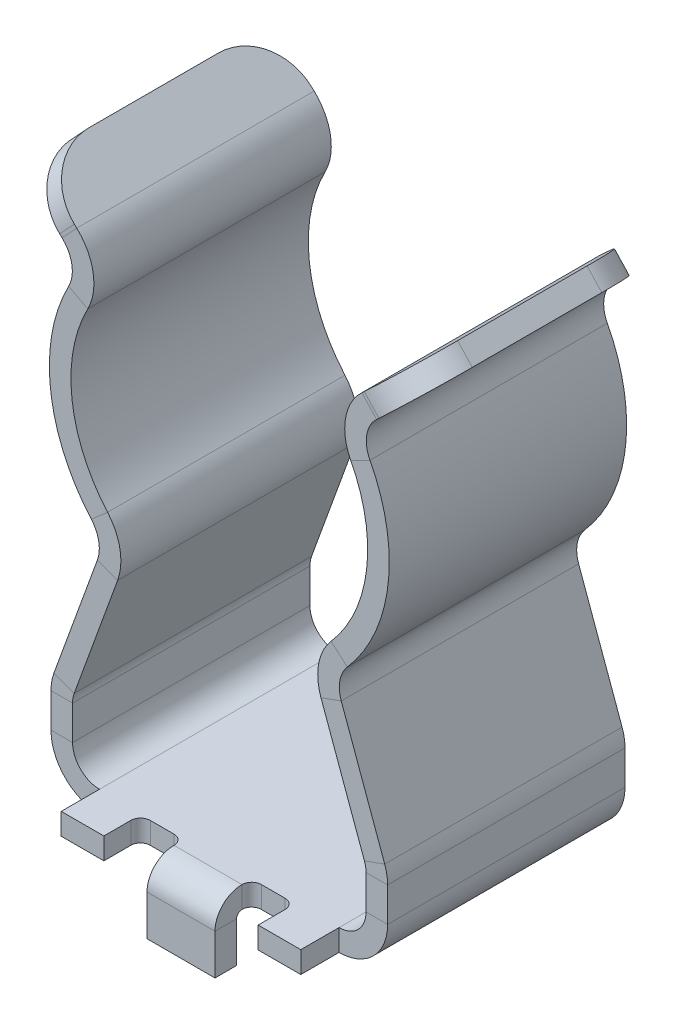
from build123d import *

# Parameters (mm, degrees)
SM_BASE_FLANGE_1_DEPTH            = 2.91
CUT_EXTRUDE_START                 = -9.92
CUT_EXTRUDE_2_OUTLINE_W           = 5
CUT_EXTRUDE_2_OUTLINE_H           = 0.71
CUT_EXTRUDE_2_DEPTH               = 9.52
CUT_EXTRUDE_START_2               = -0.4
CUT_EXTRUDE_2_2_OUTLINE_W         = 0.9
CUT_EXTRUDE_2_2_OUTLINE_H         = 0.71
CUT_EXTRUDE_2_2_DEPTH             = 0.4
SM_EDGE_FLANGE_2_STRIP_W          = 1.8
SM_EDGE_FLANGE_2_STRIP_H          = 0.4
SM_EDGE_FLANGE_2_STRIP_CUT_DEPTH  = 0.63
SM_EDGE_FLANGE_2_RELIEF_W         = 1.98
SM_EDGE_FLANGE_2_RELIEF_H         = 0.8
SM_EDGE_FLANGE_2_RELIEF_CUT_DEPTH = 0.4
SM_EDGE_FLANGE_2_DEPTH            = 0.63
FILLET_3_R                        = 0.18
CUT_EXTRUDE_4_DEPTH               = 12.348755283
FILLET_4_R                        = 1
SKETCH_33_W                       = 2.00295296
SKETCH_33_H                       = 3.384867517
CUT_EXTRUDE_5_DEPTH               = 13.417670735


# Read off the part's stored shape, not the designer's step: 切除-拉伸2
# Sheet-metal steps are written as plain solids
with BuildPart() as part:
    # Sketch 1 → 基体-法兰1 (new body)
    with BuildSketch(Plane.XY):
        with BuildLine():
            Line((-3.4172, 3.19), (-2.64194931, 2.466293544))
            ThreePointArc((-2.64194931, 2.466293544), (-2.338641394, 1.90383514), (-2.437847629, 1.272556064))
            ThreePointArc((-2.437847629, 1.272556064), (-2.730725187, -0.325023008), (-2.071040526, -1.809223905))
            ThreePointArc((-2.071040526, -1.809223905), (-1.841158131, -2.283453933), (-1.884290869, -2.808696355))
            Line((-1.884290869, -2.808696355), (-2.689927651, -5.025447504))
            ThreePointArc((-2.689927651, -5.025447504), (-2.712424525, -5.109527023), (-2.72, -5.196233927))
            Line((-2.72, -5.196233927), (-2.72, -5.83))
            ThreePointArc((-2.72, -5.83), (-2.573553391, -6.183553391), (-2.22, -6.33))
            Line((-2.22, -6.33), (0, -6.33))
            Line((0, -6.33), (0, -6.73))
            Line((0, -6.73), (-2.22, -6.73))
            ThreePointArc((-2.22, -6.73), (-2.856396103, -6.466396103), (-3.12, -5.83))
            Line((-3.12, -5.83), (-3.12, -5.196233927))
            ThreePointArc((-3.12, -5.196233927), (-3.106364145, -5.0401615), (-3.065869772, -4.888818365))
            Line((-3.065869772, -4.888818365), (-2.26023299, -2.672067216))
            ThreePointArc((-2.26023299, -2.672067216), (-2.234353348, -2.356921763), (-2.372282784, -2.072383746))
            ThreePointArc((-2.372282784, -2.072383746), (-3.127921577, -0.372299082), (-2.792443648, 1.457655128))
            ThreePointArc((-2.792443648, 1.457655128), (-2.732919907, 1.836422573), (-2.914904656, 2.173897616))
            Line((-2.914904656, 2.173897616), (-3.690155347, 2.897604072))
            Line((-3.690155347, 2.897604072), (-3.4172, 3.19))
        make_face()
    extrude(amount=SM_BASE_FLANGE_1_DEPTH)

    # 切除-拉伸2 outline → 切除-拉伸2 (cut)
    with BuildSketch(Plane.XZ.offset(6.73).offset(CUT_EXTRUDE_START)):
        with Locations((-2.5, 2.555)):
            Rectangle(CUT_EXTRUDE_2_OUTLINE_W, CUT_EXTRUDE_2_OUTLINE_H)
    extrude(amount=CUT_EXTRUDE_2_DEPTH, mode=Mode.SUBTRACT)

    # Cut-Extrude 2 2 outline → Cut-Extrude 2 2 (cut)
    with BuildSketch(Plane.XZ.offset(6.73).offset(CUT_EXTRUDE_START_2)):
        with Locations((-2.67, 2.555)):
            Rectangle(CUT_EXTRUDE_2_2_OUTLINE_W, CUT_EXTRUDE_2_2_OUTLINE_H)
    extrude(amount=CUT_EXTRUDE_2_2_DEPTH, mode=Mode.SUBTRACT)

    # 边线-法兰2 strip (across the edge) → 边线-法兰2 strip cut (cut)
    with BuildSketch(Plane(origin=(0, -6.73, 2.91), x_dir=(0, 0, -1), z_dir=(-1, 0, 0))):
        with Locations((-0.4, -0.2)):
            Rectangle(SM_EDGE_FLANGE_2_STRIP_W, SM_EDGE_FLANGE_2_STRIP_H)
    extrude(amount=SM_EDGE_FLANGE_2_STRIP_CUT_DEPTH, mode=Mode.SUBTRACT)

    # 边线-法兰2 relief (on the sheet) → 边线-法兰2 relief cut (cut)
    with BuildSketch(Plane(origin=(0, -6.73, 2.41), x_dir=(0, 0, -1), z_dir=(0, -1, 0))):
        with Locations((-0.81, -1.03)):
            Rectangle(SM_EDGE_FLANGE_2_RELIEF_W, SM_EDGE_FLANGE_2_RELIEF_H)
    extrude(amount=-SM_EDGE_FLANGE_2_RELIEF_CUT_DEPTH, mode=Mode.SUBTRACT)

    # 边线-法兰2 section (across the edge) → 边线-法兰2 (add)
    with BuildSketch(Plane(origin=(0, -6.73, 2.91), x_dir=(0, 0, -1), z_dir=(-1, 0, 0))):
        with BuildLine():
            Line((0, 0.1), (0, 3.6))
            Line((0, 3.6), (0.4, 3.6))
            Line((0.4, 3.6), (0.4, 0.1))
            ThreePointArc((0.4, 0.1), (0.429289322, 0.029289322), (0.5, 0))
            Line((0.5, 0), (0.5, -0.4))
            ThreePointArc((0.5, -0.4), (0.146446609, -0.253553391), (0, 0.1))
        make_face()
    extrude(amount=SM_EDGE_FLANGE_2_DEPTH)

    # 圆角3
    fillet_3_edges = [part.edges().sort_by_distance(p)[0] for p in [
        (-1.43, -6.53, 2.23),
        (-0.63, -6.53, 2.23),
    ]]
    fillet(fillet_3_edges, radius=FILLET_3_R)

    # 草图29 → 切除-拉伸4 (cut, through all)
    with BuildSketch(Plane.XY.offset(2.91)):
        with BuildLine():
            Line((-0.63, -8.93), (-1.33273135, -8.93))
            Line((-1.33273135, -8.93), (-1.33273135, -10.562100009))
            Line((-1.33273135, -10.562100009), (0, -10.562100009))
            Line((0, -10.562100009), (0, -10.33))
            ThreePointArc((0, -10.33), (-0.465244282, -9.697609927), (-0.63, -8.93))
        make_face()
    extrude(amount=-CUT_EXTRUDE_4_DEPTH, mode=Mode.SUBTRACT)

    # 圆角4
    fillet_4_edges = [part.edges().sort_by_distance(p)[0] for p in [
        (-3.553677673, 3.043802036, 2.2),
    ]]
    fillet(fillet_4_edges, radius=FILLET_4_R)

    # 镜向8: part across plane


with BuildPart() as part_1:
    add(part.part)
    add(part.part.mirror(Plane(origin=(0, -6.33, 2.91), x_dir=(0, 0, 1), z_dir=(1, 0, 0))))

    # 镜向9: part across plane


with BuildPart() as part_2:
    add(part_1.part)
    add(part_1.part.mirror(Plane(origin=(-2.26023299, -2.672067216, 0), x_dir=(1, 0, 0), z_dir=(0, 0, -1))))

    # 草图33 → 切除-拉伸5 (cut, through all)
    with BuildSketch(Plane.XY.offset(2.91)):
        with Locations((0, -9.272433759)):
            Rectangle(SKETCH_33_W, SKETCH_33_H)
    extrude(amount=-CUT_EXTRUDE_5_DEPTH, mode=Mode.SUBTRACT)


solid = part_2.part
